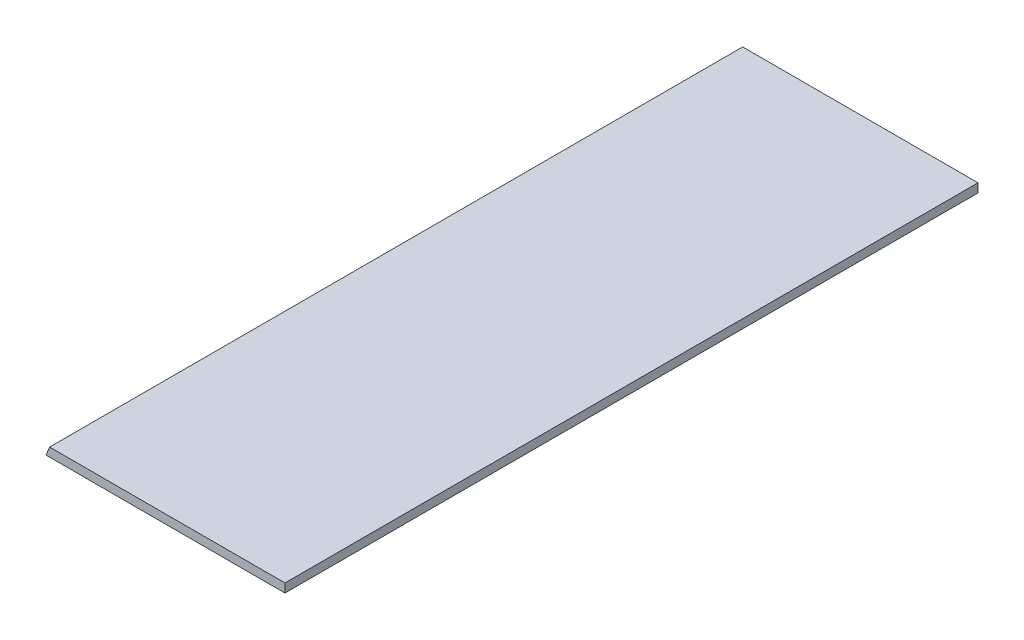
from build123d import *

# Parameters (mm, degrees)
BOSS_EXTRUDE1_DEPTH = 501.65


with BuildPart() as part:
    # Sketch1 → Boss-Extrude1 (new body)
    with BuildSketch(Plane.XY):
        Polygon((0, 0), (2.630256121, 6.35), (172.974, 6.35), (172.974, 0), align=None)
    extrude(amount=BOSS_EXTRUDE1_DEPTH)


solid = part.part
